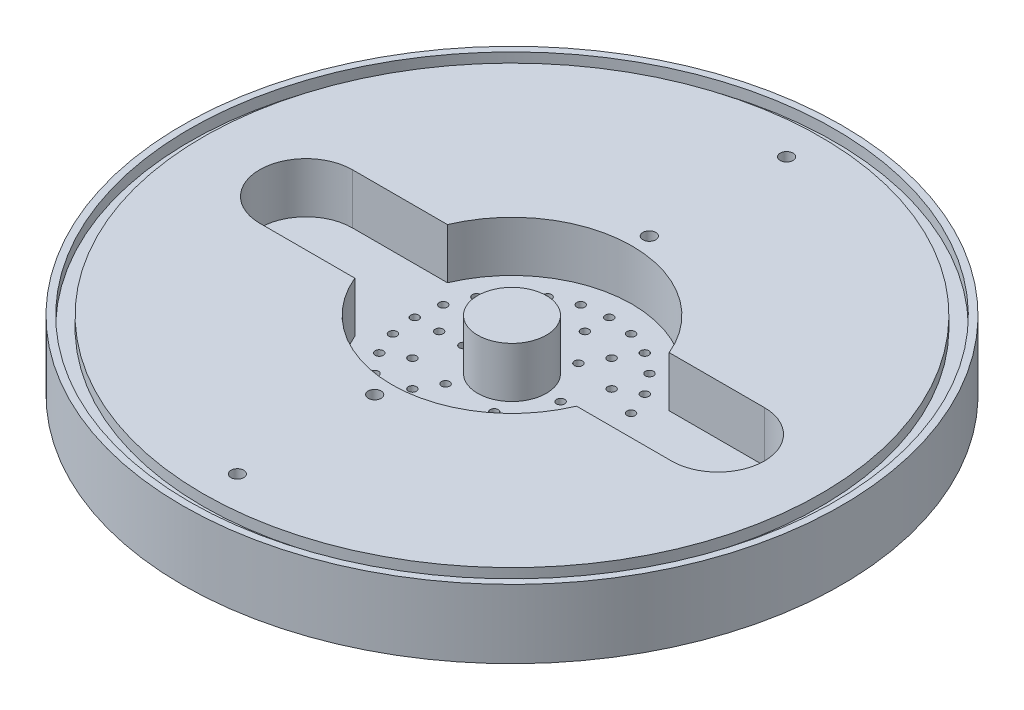
from build123d import *

# Parameters (mm, degrees)
SKETCH1_R                       = 60.96
BILLET_DEPTH                    = 12.7
SKETCH4_R                       = 0.7493
FIRST_KEROSENE_OUTLET_DEPTH     = 88.140881336
SKETCH15_R                      = 59.69
SKETCH15_R_2                    = 57.15
CHAMBER_O_RING_DEPTH            = 2.032
TOP_START                       = -2.032
SKETCH16_R                      = 59.69
SKETCH16_R_2                    = 57.15
TOP_O_RING_DEPTH                = 2.032
PRIMARY_HOLES_COUNT             = 6
SECOND_START                    = -12.7
SECOND_RING_OUTLINE_R           = 0.7493
SECOND_RING_DEPTH               = 12.7
THIRD_START                     = -12.7
THIRD_RING_OUTLINE_R            = 0.7493
THIRD_RING_DEPTH                = 12.7
KEROSENE_WELL_DEPTH             = 9.3218
SKETCH17_R                      = 6.35
BOSS_EXTRUDE1_DEPTH             = 2.54
BOSS_EXTRUDE1_DIRECTION_2_REACH = 89.141
SKETCH19_R                      = 6.35
LOX_TOWER_DEPTH                 = 2.54
SKETCH20_R                      = 1.190625
DOWELS_DEPTH                    = 3.175


# Read off the part's stored shape, not the designer's step: Second ring, Third Ring
with BuildPart() as part:
    # Sketch1 → Billet (new body)
    with BuildSketch(Plane(origin=(0, 0, 0), x_dir=(1, 0, 0), z_dir=(0, 1, 0))):
        with Locations(Location((0, 0, 0), (0, 0, 270))):
            Circle(SKETCH1_R)
    extrude(amount=-BILLET_DEPTH)

    # Sketch4 → First Kerosene Outlet (cut, symmetric)
    with BuildSketch(Plane(origin=(0, -12.7, 0), x_dir=(1, 0, 0), z_dir=(0, 1, 0))):
        with Locations(Location((8.9916, 0, 0), (0, 0, 270))):
            Circle(SKETCH4_R)
        with Locations(Location((13.4874, 0, 0), (0, 0, 270))):
            Circle(SKETCH4_R)
        with Locations(Location((17.9832, 0, 0), (0, 0, 270))):
            Circle(SKETCH4_R)
    first_kerosene_outlet = extrude(amount=FIRST_KEROSENE_OUTLET_DEPTH, both=True, mode=Mode.SUBTRACT)

    # Sketch15 → Chamber O Ring (cut)
    with BuildSketch(Plane(origin=(0, -12.7, 0), x_dir=(1, 0, 0), z_dir=(0, 1, 0))):
        with Locations(Location((0, 0, 0), (0, 0, 270))):
            Circle(SKETCH15_R)
        with Locations(Location((0, 0, 0), (0, 0, 270))):
            Circle(SKETCH15_R_2, mode=Mode.SUBTRACT)
    extrude(amount=CHAMBER_O_RING_DEPTH, mode=Mode.SUBTRACT)

    # Sketch16 → Top O ring (cut)
    with BuildSketch(Plane(origin=(0, 0, 0), x_dir=(1, 0, 0), z_dir=(0, 1, 0)).offset(TOP_START)):
        with Locations(Location((0, 0, 0), (0, 0, 270))):
            Circle(SKETCH16_R)
        with Locations(Location((0, 0, 0), (0, 0, 270))):
            Circle(SKETCH16_R_2, mode=Mode.SUBTRACT)
    extrude(amount=TOP_O_RING_DEPTH, mode=Mode.SUBTRACT)

    # Primary Holes: First Kerosene Outlet ×6 about axis
    primary_holes_axis = Axis((0, 0, 0), (0, 1, 0))
    for i in range(1, PRIMARY_HOLES_COUNT):
        add(first_kerosene_outlet.rotate(primary_holes_axis, i * 360 / PRIMARY_HOLES_COUNT), mode=Mode.SUBTRACT)

    # Second ring outline → Second ring (cut)
    with BuildSketch(Plane(origin=(0, 0, 0), x_dir=(1, 0, 0), z_dir=(0, 1, 0)).offset(SECOND_START)):
        with Locations((11.680431031, 6.7437)):
            Circle(SECOND_RING_OUTLINE_R)
        with Locations((0, 13.4874)):
            Circle(SECOND_RING_OUTLINE_R)
        with Locations((-11.680431031, 6.7437)):
            Circle(SECOND_RING_OUTLINE_R)
        with Locations((-11.680431031, -6.7437)):
            Circle(SECOND_RING_OUTLINE_R)
        with Locations((0, -13.4874)):
            Circle(SECOND_RING_OUTLINE_R)
        with Locations((11.680431031, -6.7437)):
            Circle(SECOND_RING_OUTLINE_R)
    extrude(amount=SECOND_RING_DEPTH, mode=Mode.SUBTRACT)

    # Third Ring outline → Third Ring (cut)
    with BuildSketch(Plane(origin=(0, 0, 0), x_dir=(1, 0, 0), z_dir=(0, 1, 0)).offset(THIRD_START)):
        with Locations((17.370437319, 4.654394652)):
            Circle(THIRD_RING_OUTLINE_R)
        with Locations((15.573908041, 8.9916)):
            Circle(THIRD_RING_OUTLINE_R)
        with Locations((12.716042667, 12.716042667)):
            Circle(THIRD_RING_OUTLINE_R)
        with Locations((4.654394652, 17.370437319)):
            Circle(THIRD_RING_OUTLINE_R)
        with Locations((0, 17.9832)):
            Circle(THIRD_RING_OUTLINE_R)
        with Locations((-4.654394652, 17.370437319)):
            Circle(THIRD_RING_OUTLINE_R)
        with Locations((-12.716042667, 12.716042667)):
            Circle(THIRD_RING_OUTLINE_R)
        with Locations((-15.573908041, 8.9916)):
            Circle(THIRD_RING_OUTLINE_R)
        with Locations((-17.370437319, 4.654394652)):
            Circle(THIRD_RING_OUTLINE_R)
        with Locations((-17.370437319, -4.654394652)):
            Circle(THIRD_RING_OUTLINE_R)
        with Locations((-15.573908041, -8.9916)):
            Circle(THIRD_RING_OUTLINE_R)
        with Locations((-12.716042667, -12.716042667)):
            Circle(THIRD_RING_OUTLINE_R)
        with Locations((-4.654394652, -17.370437319)):
            Circle(THIRD_RING_OUTLINE_R)
        with Locations((0, -17.9832)):
            Circle(THIRD_RING_OUTLINE_R)
        with Locations((4.654394652, -17.370437319)):
            Circle(THIRD_RING_OUTLINE_R)
        with Locations((12.716042667, -12.716042667)):
            Circle(THIRD_RING_OUTLINE_R)
        with Locations((15.573908041, -8.9916)):
            Circle(THIRD_RING_OUTLINE_R)
        with Locations((17.370437319, -4.654394652)):
            Circle(THIRD_RING_OUTLINE_R)
    extrude(amount=THIRD_RING_DEPTH, mode=Mode.SUBTRACT)

    # Sketch18 → Kerosene Well (cut)
    with BuildSketch(Plane(origin=(0, 0, 0), x_dir=(1, 0, 0), z_dir=(0, 1, 0))):
        with BuildLine():
            Line((-38.1, 8.57504), (-20.504129194, 8.57504))
            ThreePointArc((-20.504129194, 8.57504), (0, 22.225), (20.504129194, 8.57504))
            Line((20.504129194, 8.57504), (38.1, 8.57504))
            ThreePointArc((38.1, 8.57504), (46.67504, 0), (38.1, -8.57504))
            Line((38.1, -8.57504), (20.504129194, -8.57504))
            ThreePointArc((20.504129194, -8.57504), (0, -22.225), (-20.504129194, -8.57504))
            Line((-20.504129194, -8.57504), (-38.1, -8.57504))
            ThreePointArc((-38.1, -8.57504), (-46.67504, 0), (-38.1, 8.57504))
        make_face()
    extrude(amount=-KEROSENE_WELL_DEPTH, mode=Mode.SUBTRACT)

    # Sketch17 → Boss-Extrude1 (add)
    with BuildSketch(Plane(origin=(0, 0, 0), x_dir=(1, 0, 0), z_dir=(0, 1, 0))):
        with Locations(Location((0, 0, 0), (0, 0, 270))):
            Circle(SKETCH17_R)
    extrude(amount=BOSS_EXTRUDE1_DEPTH)

    # Sketch17 → Boss-Extrude1 direction 2 (add, up to next)
    with BuildSketch(Plane(origin=(0, 0, 0), x_dir=(1, 0, 0), z_dir=(0, 1, 0)), mode=Mode.PRIVATE) as boss_extrude1_direction_2_sk1:
        with Locations(Location((0, 0, 0), (0, 0, 270))):
            Circle(SKETCH17_R)
    boss_extrude1_direction_2_tool1 = extrude(boss_extrude1_direction_2_sk1.sketch, amount=-BOSS_EXTRUDE1_DIRECTION_2_REACH, mode=Mode.PRIVATE) - part.part
    add(boss_extrude1_direction_2_tool1.solids().sort_by_distance((0, 0, 0))[0])

    # Sketch19 → Lox Tower (cut)
    with BuildSketch(Plane(origin=(0, 2.54, 0), x_dir=(1, 0, 0), z_dir=(0, 1, 0))):
        with Locations(Location((0, 0, 0), (0, 0, 270))):
            Circle(SKETCH19_R)
    extrude(amount=-LOX_TOWER_DEPTH, mode=Mode.SUBTRACT)

    # Sketch20 → Dowels (cut)
    with BuildSketch(Plane(origin=(0, 0, 0), x_dir=(1, 0, 0), z_dir=(0, 1, 0))):
        with Locations(Location((0, 25.4, 0), (0, 0, 270))):
            Circle(SKETCH20_R)
        with Locations(Location((0, -25.4, 0), (0, 0, 90))):
            Circle(SKETCH20_R)
        with Locations(Location((0, 50.8, 0), (0, 0, 270))):
            Circle(SKETCH20_R)
        with Locations(Location((0, -50.8, 0), (0, 0, 90))):
            Circle(SKETCH20_R)
    extrude(amount=-DOWELS_DEPTH, mode=Mode.SUBTRACT)


solid = part.part
